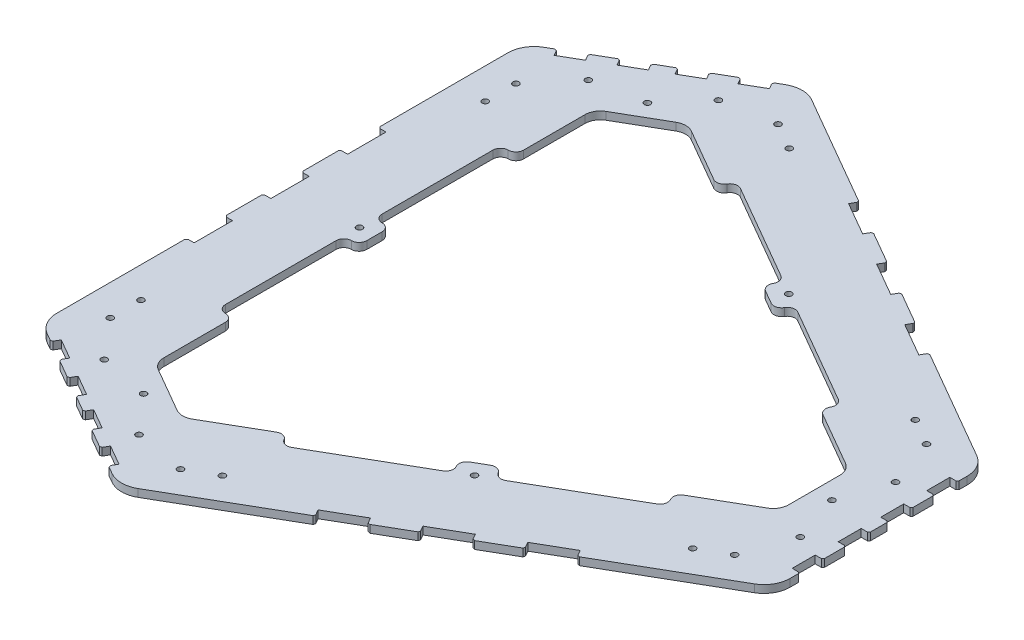
from build123d import *
from build123d.topology import SkipClean

# Parameters (mm, degrees)
STOCK_FRAME_START              = -95
STOCK_FRAME_MASTER_1_OUTLINE_R = 2
STOCK_FRAME_MASTER_1_DEPTH     = 5
CHAMFER1_SIZE                  = 1


# Read off the part's stored shape, not the designer's step: Stock-Frame master-1
with BuildPart() as part:
    # Stock-Frame master-1 outline → Stock-Frame master-1 (new body)
    with BuildSketch(Plane(origin=(0, 0, 0), x_dir=(1, 0, 0), z_dir=(0, 1, 0)).offset(STOCK_FRAME_START)):
        with BuildLine():
            Line((58.103357378, 100.637967069), (54.228357378, 93.926270189))
            Line((54.228357378, 93.926270189), (58.558484397, 91.426270189))
            ThreePointArc((58.558484397, 91.426270189), (62.352579622, 90.926768077), (65.388611416, 93.256397208))
            ThreePointArc((65.388611416, 93.256397208), (68.424643209, 95.58602634), (72.218738434, 95.086524227))
            Line((72.218738434, 95.086524227), (134.689110868, 59.019237886))
            ThreePointArc((134.689110868, 59.019237886), (137.018739999, 55.983206093), (136.519237886, 52.189110868))
            ThreePointArc((136.519237886, 52.189110868), (136.019735774, 48.395015643), (138.349364905, 45.358983849))
            Line((138.349364905, 45.358983849), (173, 25.353430349))
            ThreePointArc((173, 25.353430349), (176.660254038, 21.693176311), (178, 16.693176311))
            Line((178, 16.693176311), (178, 0))
            Line((178, 0), (187.5, 0))
            ThreePointArc((187.5, 0), (189.5, 2), (191.5, 0))
            Line((191.5, 0), (220, 0))
            Line((220, 0), (220, 6.342522712))
            Line((220, 6.342522712), (215, 6.342522712))
            Line((215, 6.342522712), (215, 21.342522712))
            Line((215, 21.342522712), (220, 21.342522712))
            Line((220, 21.342522712), (220, 36.342522712))
            Line((220, 36.342522712), (215, 36.342522712))
            Line((215, 36.342522712), (215, 51.342522712))
            Line((215, 51.342522712), (220, 51.342522712))
            Line((220, 51.342522712), (220, 57.685045424))
            ThreePointArc((220, 57.685045424), (217.722431864, 66.185045424), (211.5, 72.407477288))
            Line((211.5, 72.407477288), (138.354945114, 114.637794416))
            Line((138.354945114, 114.637794416), (135.854945114, 110.307667397))
            Line((135.854945114, 110.307667397), (114.20431002, 122.807667397))
            Line((114.20431002, 122.807667397), (116.70431002, 127.137794416))
            Line((116.70431002, 127.137794416), (95.053674925, 139.637794416))
            Line((95.053674925, 139.637794416), (92.553674925, 135.307667397))
            Line((92.553674925, 135.307667397), (81.728357378, 141.557667397))
            Line((81.728357378, 141.557667397), (60.103357378, 104.102068684))
            ThreePointArc((60.103357378, 104.102068684), (60.835408185, 101.370017877), (58.103357378, 100.637967069))
        make_face()
        with Locations((200, 31)):
            Circle(STOCK_FRAME_MASTER_1_OUTLINE_R, mode=Mode.SUBTRACT)
        with Locations((188.660254038, 62.5)):
            Circle(STOCK_FRAME_MASTER_1_OUTLINE_R, mode=Mode.SUBTRACT)
        with Locations((171.339745962, 72.5)):
            Circle(STOCK_FRAME_MASTER_1_OUTLINE_R, mode=Mode.SUBTRACT)
    extrude(amount=STOCK_FRAME_MASTER_1_DEPTH)

    # Mirror1: part across plane


with BuildPart() as part_1:
    add(part.part)
    add(part.part.mirror(Plane(origin=(0, -90, 0), x_dir=(-0.49999999999999406, 0, 0.866025403784442), z_dir=(0.8660254037844419, 0, 0.4999999999999941))))


with BuildPart() as body_2:
    # Mirror2: mirrored copy
    add(part_1.part.mirror(Plane(origin=(220, -90, 0), x_dir=(1, 0, 0), z_dir=(0, 0, -1))))

    # Mirror3: body 2 across plane


with BuildPart() as body_2_1:
    with SkipClean():  # the faces are left unmerged after this step: merging them gives an invalid solid
        add(body_2.part)
        add(body_2.part.mirror(Plane(origin=(-110, -90, 190.525588833), x_dir=(-0.5000000000000117, 0, 0.866025403784432), z_dir=(0.866025403784432, 0, 0.5000000000000115))))


with BuildPart() as part_2:
    add(part_1.part)

    # Combine1: union body 2
    add(body_2_1.part)

    # Chamfer1
    chamfer1_edges = [part_2.edges().sort_by_distance(p)[0] for p in [
        (95.053674925, -92.5, -139.637794416),
        (-104.507214207, -92.5, -193.696850189),
        (-91.516833151, -92.5, -201.196850189),
        (-78.526452094, -92.5, -208.696850189),
        (-65.536071037, -92.5, -216.196850189),
        (30.101769641, -92.5, -177.137794416),
        (51.752404735, -92.5, -164.637794416),
        (73.40303983, -92.5, -152.137794416),
        (220, -92.5, 6.342522712),
        (220, -92.5, 21.342522712),
        (220, -92.5, 36.342522712),
        (220, -92.5, 51.342522712),
        (138.354945114, -92.5, 114.637794416),
        (116.70431002, -92.5, 127.137794416),
        (95.053674925, -92.5, 139.637794416),
        (-115.492785793, -92.5, 187.354327477),
        (-104.507214207, -92.5, 193.696850189),
        (-91.516833151, -92.5, 201.196850189),
        (-78.526452094, -92.5, 208.696850189),
        (-65.536071037, -92.5, 216.196850189),
        (30.101769641, -92.5, 177.137794416),
        (51.752404735, -92.5, 164.637794416),
        (73.40303983, -92.5, 152.137794416),
        (-115.492785793, -92.5, -187.354327477),
        (-128.483166849, -92.5, -179.854327477),
        (-141.473547906, -92.5, -172.354327477),
        (-154.463928963, -92.5, -164.854327477),
        (-168.456714755, -92.5, -62.5),
        (-168.456714755, -92.5, -37.5),
        (-168.456714755, -92.5, -12.5),
        (-128.483166849, -92.5, 179.854327477),
        (-141.473547906, -92.5, 172.354327477),
        (-154.463928963, -92.5, 164.854327477),
        (-168.456714755, -92.5, 62.5),
        (-168.456714755, -92.5, 37.5),
        (-168.456714755, -92.5, 12.5),
        (138.354945114, -92.5, -114.637794416),
        (116.70431002, -92.5, -127.137794416),
        (220, -92.5, -36.342522712),
        (220, -92.5, -51.342522712),
        (220, -92.5, -6.342522712),
        (220, -92.5, -21.342522712),
    ]]
    chamfer(chamfer1_edges, length=CHAMFER1_SIZE)


solid = part_2.part
